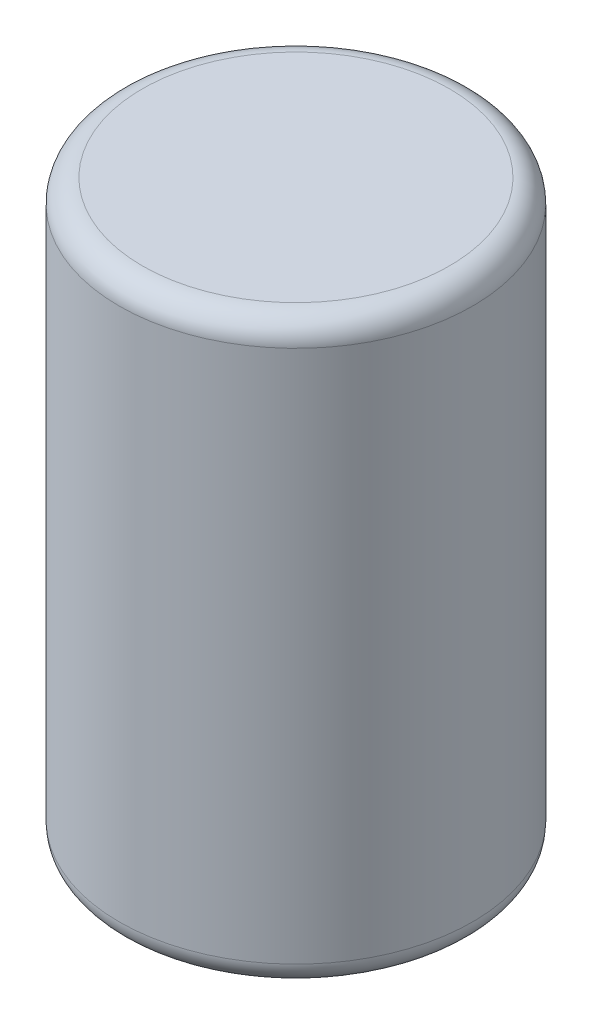
from build123d import *

# Parameters (mm, degrees)
SKETCH2_R           = 76.2
BOSS_EXTRUDE1_DEPTH = 250
FILLET1_R           = 10


with BuildPart() as part:
    # Sketch2 → Boss-Extrude1 (new body)
    with BuildSketch(Plane(origin=(0, 0, 0), x_dir=(1, 0, 0), z_dir=(0, 1, 0))):
        Circle(SKETCH2_R)
    extrude(amount=BOSS_EXTRUDE1_DEPTH)

    # Fillet1
    fillet1_edges = [part.edges().sort_by_distance(p)[0] for p in [
        (-76.2, 0, 0),
        (-76.2, 250, 0),
    ]]
    fillet(fillet1_edges, radius=FILLET1_R)


solid = part.part
